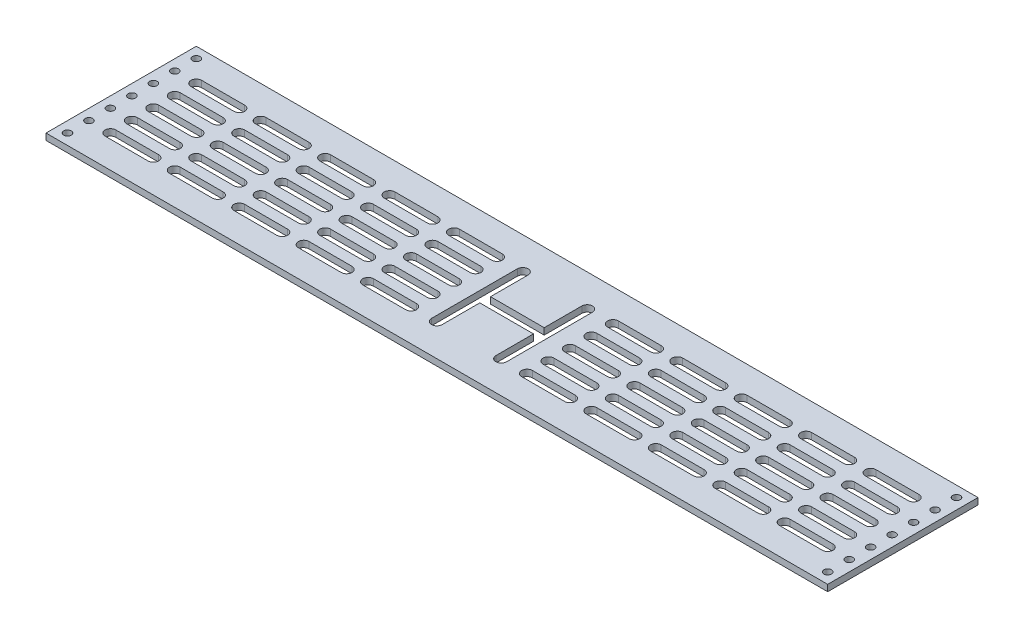
from build123d import *

# Parameters (mm, degrees)
EXTRUDE_1_DEPTH     = 3
SKETCH_2_R          = 1.75
CUT_EXTRUDE_1_DEPTH = 199.829072321
CUT_EXTRUDE_4_DEPTH = 199.829072321
CUT_EXTRUDE_3_DEPTH = 10


with BuildPart() as part:
    # 草图1 → 凸台-拉伸1 (new body)
    with BuildSketch(Plane(origin=(0, 0, 0), x_dir=(1, 0, 0), z_dir=(0, 1, 0))):
        Polygon((0, 0), (-182, 0), (-182, -80), (182, -80), (182, 0), align=None)
    extrude(amount=EXTRUDE_1_DEPTH)

    # 草图2 → 切除-拉伸1 (cut, through all)
    with BuildSketch(Plane(origin=(0, 3, 0), x_dir=(1, 0, 0), z_dir=(0, 1, 0))):
        with Locations((-177, -75)):
            Circle(SKETCH_2_R)
        with Locations((-177, -5)):
            Circle(SKETCH_2_R)
        with Locations((-177, -15)):
            Circle(SKETCH_2_R)
        with Locations((-177, -25)):
            Circle(SKETCH_2_R)
        with Locations((-177, -35)):
            Circle(SKETCH_2_R)
        with Locations((-177, -45)):
            Circle(SKETCH_2_R)
        with Locations((-177, -55)):
            Circle(SKETCH_2_R)
        with Locations((-177, -65)):
            Circle(SKETCH_2_R)
        with Locations((177, -5)):
            Circle(SKETCH_2_R)
        with Locations((177, -15)):
            Circle(SKETCH_2_R)
        with Locations((177, -25)):
            Circle(SKETCH_2_R)
        with Locations((177, -35)):
            Circle(SKETCH_2_R)
        with Locations((177, -45)):
            Circle(SKETCH_2_R)
        with Locations((177, -55)):
            Circle(SKETCH_2_R)
        with Locations((177, -65)):
            Circle(SKETCH_2_R)
        with Locations((177, -75)):
            Circle(SKETCH_2_R)
    extrude(amount=-CUT_EXTRUDE_1_DEPTH, mode=Mode.SUBTRACT)

    # 草图3 → 切除-拉伸4 (cut, through all)
    with BuildSketch(Plane(origin=(0, 3, 0), x_dir=(1, 0, 0), z_dir=(0, 1, 0))):
        with BuildLine():
            Line((-12.5, -47.5), (0, -47.5))
            Line((0, -47.5), (12.5, -47.5))
            Line((12.5, -47.5), (12.5, -65))
            ThreePointArc((12.5, -65), (15, -67.5), (17.5, -65))
            Line((17.5, -65), (17.5, -25))
            ThreePointArc((17.5, -25), (15, -22.5), (12.5, -25))
            Line((12.5, -25), (12.5, -42.5))
            Line((12.5, -42.5), (-12.5, -42.5))
            Line((-12.5, -42.5), (-12.5, -25))
            ThreePointArc((-12.5, -25), (-15, -22.5), (-17.5, -25))
            Line((-17.5, -25), (-17.5, -65))
            ThreePointArc((-17.5, -65), (-15, -67.5), (-12.5, -65))
            Line((-12.5, -65), (-12.5, -47.5))
        make_face()
        with BuildLine():
            ThreePointArc((-147, -67.5), (-144.5, -65), (-147, -62.5))
            Line((-147, -62.5), (-167, -62.5))
            ThreePointArc((-167, -62.5), (-169.5, -65), (-167, -67.5))
            Line((-167, -67.5), (-147, -67.5))
        make_face()
        with BuildLine():
            ThreePointArc((-117, -67.5), (-114.5, -65), (-117, -62.5))
            Line((-117, -62.5), (-137, -62.5))
            ThreePointArc((-137, -62.5), (-139.5, -65), (-137, -67.5))
            Line((-137, -67.5), (-117, -67.5))
        make_face()
        with BuildLine():
            Line((-147, -42.5), (-157, -42.5))
            Line((-157, -42.5), (-167, -42.5))
            ThreePointArc((-167, -42.5), (-169.5, -45), (-167, -47.5))
            Line((-167, -47.5), (-147, -47.5))
            ThreePointArc((-147, -47.5), (-144.5, -45), (-147, -42.5))
        make_face()
        with BuildLine():
            Line((-147, -32.5), (-167, -32.5))
            ThreePointArc((-167, -32.5), (-169.5, -35), (-167, -37.5))
            Line((-167, -37.5), (-147, -37.5))
            ThreePointArc((-147, -37.5), (-144.5, -35), (-147, -32.5))
        make_face()
        with BuildLine():
            ThreePointArc((-147, -27.5), (-144.5, -25), (-147, -22.5))
            Line((-147, -22.5), (-167, -22.5))
            ThreePointArc((-167, -22.5), (-169.5, -25), (-167, -27.5))
            Line((-167, -27.5), (-147, -27.5))
        make_face()
        with BuildLine():
            ThreePointArc((-117, -27.5), (-114.5, -25), (-117, -22.5))
            Line((-117, -22.5), (-137, -22.5))
            ThreePointArc((-137, -22.5), (-139.5, -25), (-137, -27.5))
            Line((-137, -27.5), (-117, -27.5))
        make_face()
        with BuildLine():
            ThreePointArc((-47, -22.5), (-48.767766953, -23.232233047), (-49.5, -25))
            ThreePointArc((-49.5, -25), (-48.767766953, -26.767766953), (-47, -27.5))
            Line((-47, -27.5), (-27, -27.5))
            ThreePointArc((-27, -27.5), (-24.5, -25), (-27, -22.5))
            Line((-27, -22.5), (-47, -22.5))
        make_face()
        with BuildLine():
            ThreePointArc((-77, -22.5), (-79.5, -25), (-77, -27.5))
            Line((-77, -27.5), (-57, -27.5))
            ThreePointArc((-57, -27.5), (-54.5, -25), (-57, -22.5))
            Line((-57, -22.5), (-77, -22.5))
        make_face()
        with BuildLine():
            Line((-107, -27.5), (-87, -27.5))
            ThreePointArc((-87, -27.5), (-84.5, -25), (-87, -22.5))
            Line((-87, -22.5), (-107, -22.5))
            ThreePointArc((-107, -22.5), (-109.5, -25), (-107, -27.5))
        make_face()
        with BuildLine():
            Line((-107, -37.5), (-87, -37.5))
            ThreePointArc((-87, -37.5), (-84.5, -35), (-87, -32.5))
            Line((-87, -32.5), (-107, -32.5))
            ThreePointArc((-107, -32.5), (-109.5, -35), (-107, -37.5))
        make_face()
        with BuildLine():
            Line((-107, -47.5), (-87, -47.5))
            ThreePointArc((-87, -47.5), (-84.5, -45), (-87, -42.5))
            Line((-87, -42.5), (-107, -42.5))
            ThreePointArc((-107, -42.5), (-109.5, -45), (-107, -47.5))
        make_face()
        with BuildLine():
            Line((-107, -57.5), (-87, -57.5))
            ThreePointArc((-87, -57.5), (-84.5, -55), (-87, -52.5))
            Line((-87, -52.5), (-107, -52.5))
            ThreePointArc((-107, -52.5), (-109.5, -55), (-107, -57.5))
        make_face()
        with BuildLine():
            ThreePointArc((-47, -62.5), (-48.767766953, -63.232233047), (-49.5, -65))
            ThreePointArc((-49.5, -65), (-48.767766953, -66.767766953), (-47, -67.5))
            Line((-47, -67.5), (-27, -67.5))
            ThreePointArc((-27, -67.5), (-24.5, -65), (-27, -62.5))
            Line((-27, -62.5), (-47, -62.5))
        make_face()
        with BuildLine():
            ThreePointArc((-77, -62.5), (-79.5, -65), (-77, -67.5))
            Line((-77, -67.5), (-57, -67.5))
            ThreePointArc((-57, -67.5), (-54.5, -65), (-57, -62.5))
            Line((-57, -62.5), (-77, -62.5))
        make_face()
        with BuildLine():
            Line((-107, -67.5), (-87, -67.5))
            ThreePointArc((-87, -67.5), (-84.5, -65), (-87, -62.5))
            Line((-87, -62.5), (-107, -62.5))
            ThreePointArc((-107, -62.5), (-109.5, -65), (-107, -67.5))
        make_face()
        with BuildLine():
            ThreePointArc((-167, -52.5), (-169.5, -55), (-167, -57.5))
            Line((-167, -57.5), (-147, -57.5))
            ThreePointArc((-147, -57.5), (-144.5, -55), (-147, -52.5))
            Line((-147, -52.5), (-167, -52.5))
        make_face()
        with BuildLine():
            ThreePointArc((-137, -52.5), (-139.5, -55), (-137, -57.5))
            Line((-137, -57.5), (-117, -57.5))
            ThreePointArc((-117, -57.5), (-114.5, -55), (-117, -52.5))
            Line((-117, -52.5), (-137, -52.5))
        make_face()
        with BuildLine():
            ThreePointArc((-77, -52.5), (-79.5, -55), (-77, -57.5))
            Line((-77, -57.5), (-57, -57.5))
            ThreePointArc((-57, -57.5), (-54.5, -55), (-57, -52.5))
            Line((-57, -52.5), (-77, -52.5))
        make_face()
        with BuildLine():
            ThreePointArc((-137, -42.5), (-139.5, -45), (-137, -47.5))
            Line((-137, -47.5), (-117, -47.5))
            ThreePointArc((-117, -47.5), (-114.5, -45), (-117, -42.5))
            Line((-117, -42.5), (-137, -42.5))
        make_face()
        with BuildLine():
            ThreePointArc((-77, -42.5), (-79.5, -45), (-77, -47.5))
            Line((-77, -47.5), (-57, -47.5))
            ThreePointArc((-57, -47.5), (-54.5, -45), (-57, -42.5))
            Line((-57, -42.5), (-77, -42.5))
        make_face()
        with BuildLine():
            ThreePointArc((-137, -32.5), (-139.5, -35), (-137, -37.5))
            Line((-137, -37.5), (-117, -37.5))
            ThreePointArc((-117, -37.5), (-114.5, -35), (-117, -32.5))
            Line((-117, -32.5), (-137, -32.5))
        make_face()
        with BuildLine():
            ThreePointArc((-77, -32.5), (-79.5, -35), (-77, -37.5))
            Line((-77, -37.5), (-57, -37.5))
            ThreePointArc((-57, -37.5), (-54.5, -35), (-57, -32.5))
            Line((-57, -32.5), (-77, -32.5))
        make_face()
        with BuildLine():
            ThreePointArc((-47, -52.5), (-49.5, -55), (-47, -57.5))
            Line((-47, -57.5), (-27, -57.5))
            ThreePointArc((-27, -57.5), (-24.5, -55), (-27, -52.5))
            Line((-27, -52.5), (-47, -52.5))
        make_face()
        with BuildLine():
            ThreePointArc((-47, -42.5), (-49.5, -45), (-47, -47.5))
            Line((-47, -47.5), (-27, -47.5))
            ThreePointArc((-27, -47.5), (-24.5, -45), (-27, -42.5))
            Line((-27, -42.5), (-47, -42.5))
        make_face()
        with BuildLine():
            ThreePointArc((-47, -32.5), (-49.5, -35), (-47, -37.5))
            Line((-47, -37.5), (-27, -37.5))
            ThreePointArc((-27, -37.5), (-24.5, -35), (-27, -32.5))
            Line((-27, -32.5), (-47, -32.5))
        make_face()
    cut_extrude_4 = extrude(amount=-CUT_EXTRUDE_4_DEPTH, mode=Mode.SUBTRACT)

    # 草图4 → 切除-拉伸3 (cut)
    with BuildSketch(Plane.XZ):
        Polygon((182.116628746, 10), (177, 10), (-182, 10), (-182, 0), (182, 0), align=None)
    extrude(amount=-CUT_EXTRUDE_3_DEPTH, mode=Mode.SUBTRACT)

    # 镜向1: 切除-拉伸4 across plane
    add(cut_extrude_4.mirror(Plane(origin=(0, 0, 0), x_dir=(0, 0, 1), z_dir=(1, 0, 0))), mode=Mode.SUBTRACT)


solid = part.part
